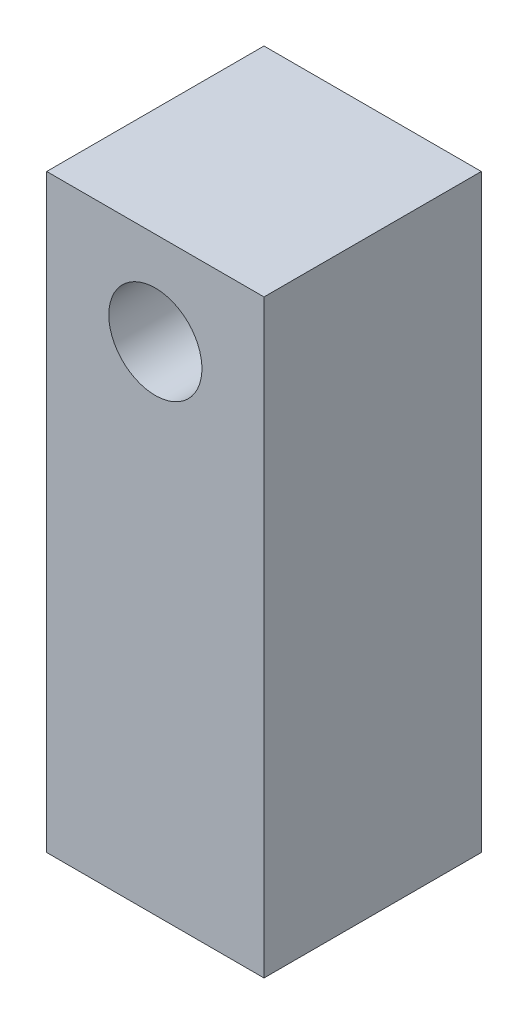
from build123d import *

# Parameters (mm, degrees)
SKETCH1_W                       = 7
SKETCH1_H                       = 7
SKETCH1_R                       = 2
BOSS_EXTRUDE1_DEPTH             = 13
BOSS_EXTRUDE2_REACH             = 15.91
SKETCH2_W                       = 7
SKETCH2_H                       = 6
SKETCH2_R                       = 1.5
BOSS_EXTRUDE2_DIRECTION_2_REACH = 15.91


with BuildPart() as part:
    # Sketch1 → Boss-Extrude1 (new body)
    with BuildSketch(Plane(origin=(0, 0, 0), x_dir=(1, 0, 0), z_dir=(0, 1, 0))):
        Rectangle(SKETCH1_W, SKETCH1_H)
        Circle(SKETCH1_R, mode=Mode.SUBTRACT)
    extrude(amount=BOSS_EXTRUDE1_DEPTH)

    # Boss-Extrude2: up to this face of the body (flat: up to its plane)
    boss_extrude2_end = Plane(part.part.faces().sort_by_distance((0, 6.5, 3.5))[0])
    # Sketch2 → Boss-Extrude2 (add, up to the picked face)
    with BuildSketch(Plane.XY, mode=Mode.PRIVATE) as boss_extrude2_sk1:
        with Locations((0, 16)):
            Rectangle(SKETCH2_W, SKETCH2_H)
        with Locations((0, 16)):
            Circle(SKETCH2_R, mode=Mode.SUBTRACT)
    boss_extrude2_tool1 = split(extrude(boss_extrude2_sk1.sketch, amount=BOSS_EXTRUDE2_REACH, mode=Mode.PRIVATE), bisect_by=boss_extrude2_end, keep=Keep.BOTH, mode=Mode.PRIVATE)
    add(boss_extrude2_tool1.solids().sort_by(Axis((0, 18.907805, 0), (0, 0, 1)))[0])

    # Boss-Extrude2 direction 2: up to this face of the body (flat: up to its plane)
    boss_extrude2_direction_2_end = Plane(part.part.faces().sort_by_distance((0, 6.5, -3.5))[0])
    # Sketch2 → Boss-Extrude2 direction 2 (add, up to the picked face)
    with BuildSketch(Plane.XY, mode=Mode.PRIVATE) as boss_extrude2_direction_2_sk1:
        with Locations((0, 16)):
            Rectangle(SKETCH2_W, SKETCH2_H)
        with Locations((0, 16)):
            Circle(SKETCH2_R, mode=Mode.SUBTRACT)
    boss_extrude2_direction_2_tool1 = split(extrude(boss_extrude2_direction_2_sk1.sketch, amount=-BOSS_EXTRUDE2_DIRECTION_2_REACH, mode=Mode.PRIVATE), bisect_by=boss_extrude2_direction_2_end, keep=Keep.BOTH, mode=Mode.PRIVATE)
    add(boss_extrude2_direction_2_tool1.solids().sort_by(Axis((0, 18.907805, 0), (0, 0, -1)))[0])


solid = part.part
